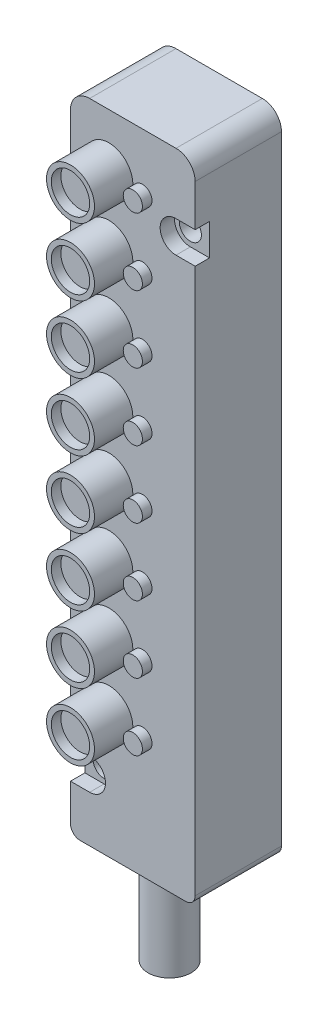
from build123d import *

# Parameters (mm, degrees)
BOSS_EXTRU_1_DEPTH         = 18
ESQUISSE2_R                = 2.3
ENL_V_MAT_EXTRU_1_DEPTH    = 3
ESQUISSE4_R                = 2.3
ENL_V_MAT_EXTRU_2_DEPTH    = 72.05807484
ESQUISSE5_R                = 2.3
ENL_V_MAT_EXTRU_3_DEPTH    = 3
ESQUISSE6_R                = 2.3
ENL_V_MAT_EXTRU_4_DEPTH    = 72.05807484
ESQUISSE7_R                = 4
BOSS_EXTRU_2_DEPTH         = 6
ESQUISSE7_5_R              = 5
ESQUISSE7_5_R_2            = 4
BOSS_EXTRU_3_DEPTH         = 8
R_P_TITION_LIN_AIRE1_COUNT = 8
R_P_TITION_LIN_AIRE1_PITCH = 14
ESQUISSE8_R                = 2
BOSS_EXTRU_4_DEPTH         = 2
R_P_TITION_LIN_AIRE2_COUNT = 8
R_P_TITION_LIN_AIRE2_PITCH = 14
ESQUISSE9_R                = 4.5
BOSS_EXTRU_5_DEPTH         = 20


with BuildPart() as part:
    # Esquisse1 → Boss.-Extru.1 (new body)
    with BuildSketch(Plane.XY):
        with BuildLine():
            Line((-11, -67.5), (11, -67.5))
            ThreePointArc((11, -67.5), (12.414213562, -66.914213562), (13, -65.5))
            Line((13, -65.5), (13, 63.5))
            ThreePointArc((13, 63.5), (11.828427125, 66.328427125), (9, 67.5))
            Line((9, 67.5), (-9, 67.5))
            ThreePointArc((-9, 67.5), (-11.828427125, 66.328427125), (-13, 63.5))
            Line((-13, 63.5), (-13, -65.5))
            ThreePointArc((-13, -65.5), (-12.414213562, -66.914213562), (-11, -67.5))
        make_face()
    extrude(amount=BOSS_EXTRU_1_DEPTH)

    # Esquisse2 → Enlèv. mat.-Extru.1 (cut)
    with BuildSketch(Plane.XY.offset(18)):
        with BuildLine():
            Line((9, 54.8), (19.370645643, 54.8))
            ThreePointArc((19.370645643, 54.8), (22.670645643, 51.5), (19.370645643, 48.2))
            Line((19.370645643, 48.2), (9, 48.2))
            ThreePointArc((9, 48.2), (5.7, 51.5), (9, 54.8))
        make_face()
        with Locations((9, 51.5)):
            Circle(ESQUISSE2_R, mode=Mode.SUBTRACT)
    extrude(amount=-ENL_V_MAT_EXTRU_1_DEPTH, mode=Mode.SUBTRACT)

    # Esquisse4 → Enlèv. mat.-Extru.2 (cut, through all)
    with BuildSketch(Plane.XY.offset(18)):
        with Locations((9, 51.5)):
            Circle(ESQUISSE4_R)
    extrude(amount=-ENL_V_MAT_EXTRU_2_DEPTH, mode=Mode.SUBTRACT)

    # Esquisse5 → Enlèv. mat.-Extru.3 (cut)
    with BuildSketch(Plane.XY.offset(18)):
        with BuildLine():
            Line((-9, -57.8), (-17.299115246, -57.8))
            ThreePointArc((-17.299115246, -57.8), (-20.599115246, -54.5), (-17.299115246, -51.2))
            Line((-17.299115246, -51.2), (-9, -51.2))
            ThreePointArc((-9, -51.2), (-5.7, -54.5), (-9, -57.8))
        make_face()
        with Locations((-9, -54.5)):
            Circle(ESQUISSE5_R, mode=Mode.SUBTRACT)
    extrude(amount=-ENL_V_MAT_EXTRU_3_DEPTH, mode=Mode.SUBTRACT)

    # Esquisse6 → Enlèv. mat.-Extru.4 (cut, through all)
    with BuildSketch(Plane.XY.offset(18)):
        with Locations((-9, -54.5)):
            Circle(ESQUISSE6_R)
    extrude(amount=-ENL_V_MAT_EXTRU_4_DEPTH, mode=Mode.SUBTRACT)

    # Esquisse7 → Boss.-Extru.2 (add)
    with BuildSketch(Plane.XY.offset(18)):
        with Locations((-5, -41.5)):
            Circle(ESQUISSE7_R)
    boss_extru_2 = extrude(amount=BOSS_EXTRU_2_DEPTH)

    # Esquisse7<5> → Boss.-Extru.3 (add)
    with BuildSketch(Plane.XY.offset(18)):
        with Locations((-5, -41.5)):
            Circle(ESQUISSE7_5_R)
        with Locations((-5, -41.5)):
            Circle(ESQUISSE7_5_R_2, mode=Mode.SUBTRACT)
    boss_extru_3 = extrude(amount=BOSS_EXTRU_3_DEPTH)

    # Répétition linéaire1: Boss.-Extru.2, Boss.-Extru.3 ×8
    with Locations(*[(0, i * R_P_TITION_LIN_AIRE1_PITCH, 0) for i in range(1, R_P_TITION_LIN_AIRE1_COUNT)]):
        add(boss_extru_2)
        add(boss_extru_3)

    # Esquisse8 → Boss.-Extru.4 (add)
    with BuildSketch(Plane.XY.offset(18)):
        with Locations((2, -42.5)):
            Circle(ESQUISSE8_R)
    boss_extru_4 = extrude(amount=BOSS_EXTRU_4_DEPTH)

    # Répétition linéaire2: Boss.-Extru.4 ×8
    with Locations(*[(0, i * R_P_TITION_LIN_AIRE2_PITCH, 0) for i in range(1, R_P_TITION_LIN_AIRE2_COUNT)]):
        add(boss_extru_4)

    # Esquisse9 → Boss.-Extru.5 (add)
    with BuildSketch(Plane.XZ.offset(67.5)):
        with Locations((0, 10.336677371)):
            Circle(ESQUISSE9_R)
    extrude(amount=BOSS_EXTRU_5_DEPTH)


solid = part.part
